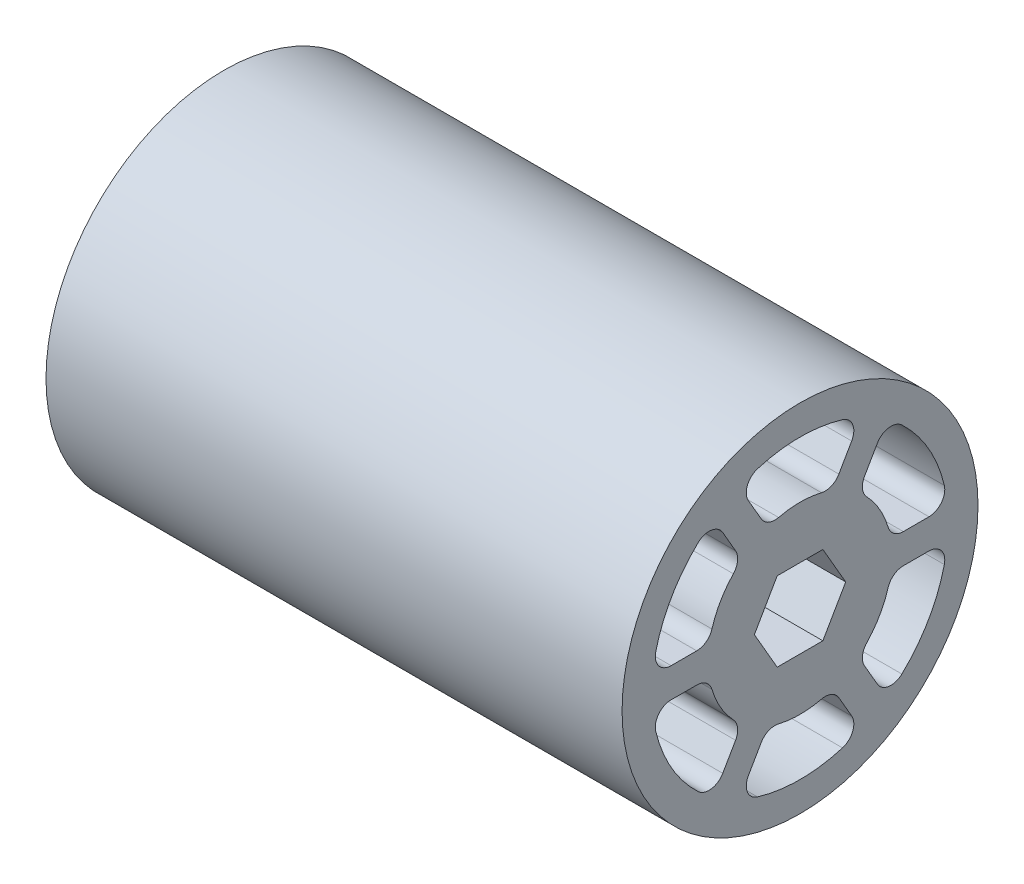
from build123d import *

# Parameters (mm, degrees)
CROQUIS1_R              = 28.575
SALIENTE_EXTRUIR1_DEPTH = 92.5
CORTAR_EXTRUIR1_DEPTH   = 101.942118315


with BuildPart() as part:
    # Croquis1 → Saliente-Extruir1 (new body)
    with BuildSketch(Plane(origin=(0, 0, 0), x_dir=(0, 0, -1), z_dir=(1, 0, 0))):
        Circle(CROQUIS1_R)
        Polygon((7.332348419, 0), (3.666174209, 6.35), (-3.666174209, 6.35), (-7.332348419, 0), (-3.666174209, -6.35), (3.666174209, -6.35), align=None, mode=Mode.SUBTRACT)
    extrude(amount=SALIENTE_EXTRUIR1_DEPTH)

    # Croquis2 → Cortar-Extruir1 (cut, through all)
    with BuildSketch(Plane(origin=(92.5, 0, 0), x_dir=(0, 0, -1), z_dir=(1, 0, 0))):
        with BuildLine():
            Line((-6.233796171, 15.550729765), (-8.292494443, 19.11649977))
            ThreePointArc((-8.292494443, 19.11649977), (-8.452873942, 21.324398032), (-6.820383997, 22.8195612))
            ThreePointArc((-6.820383997, 22.8195612), (0, 23.817682129), (6.820383997, 22.8195612))
            ThreePointArc((6.820383997, 22.8195612), (8.452873942, 21.324398032), (8.292494443, 19.11649977))
            Line((8.292494443, 19.11649977), (6.233796171, 15.550729765))
            ThreePointArc((6.233796171, 15.550729765), (5.037217596, 14.487169273), (3.442097, 14.350965426))
            ThreePointArc((3.442097, 14.350965426), (0, 14.758215751), (-3.442097, 14.350965426))
            ThreePointArc((-3.442097, 14.350965426), (-5.037136467, 14.487358051), (-6.233796171, 15.550729765))
        make_face()
        with BuildLine():
            Line((16.584225109, 2.376739037), (20.701621654, 2.376739037))
            ThreePointArc((20.701621654, 2.376739037), (22.693907387, 3.341795447), (23.172511701, 5.503154795))
            ThreePointArc((23.172511701, 5.503154795), (20.626717783, 11.908841064), (16.352127704, 17.316406405))
            ThreePointArc((16.352127704, 17.316406405), (14.241033445, 17.982602585), (12.409127211, 16.739760733))
            Line((12.409127211, 16.739760733), (10.350428939, 13.173990728))
            ThreePointArc((10.350428939, 13.173990728), (10.027851873, 11.605967168), (10.707252128, 10.156426157))
            ThreePointArc((10.707252128, 10.156426157), (12.780989755, 7.379107875), (14.149349128, 4.194539269))
            ThreePointArc((14.149349128, 4.194539269), (15.064865418, 2.881226234), (16.584225109, 2.376739037))
        make_face()
        with BuildLine():
            Line((10.350428939, -13.173990728), (12.409127211, -16.739760733))
            ThreePointArc((12.409127211, -16.739760733), (14.241033445, -17.982602585), (16.352127704, -17.316406405))
            ThreePointArc((16.352127704, -17.316406405), (20.626717783, -11.908841064), (23.172511701, -5.503154795))
            ThreePointArc((23.172511701, -5.503154795), (22.693907387, -3.341795447), (20.701621654, -2.376739037))
            Line((20.701621654, -2.376739037), (16.584225109, -2.376739037))
            ThreePointArc((16.584225109, -2.376739037), (15.064988339, -2.881390883), (14.149349128, -4.194539269))
            ThreePointArc((14.149349128, -4.194539269), (12.780989755, -7.379107875), (10.707252128, -10.156426157))
            ThreePointArc((10.707252128, -10.156426157), (10.027647822, -11.605943039), (10.350428939, -13.173990728))
        make_face()
        with BuildLine():
            Line((-6.233796171, -15.550729765), (-8.292494443, -19.11649977))
            ThreePointArc((-8.292494443, -19.11649977), (-8.452873942, -21.324398032), (-6.820383997, -22.8195612))
            ThreePointArc((-6.820383997, -22.8195612), (0, -23.817682129), (6.820383997, -22.8195612))
            ThreePointArc((6.820383997, -22.8195612), (8.452873942, -21.324398032), (8.292494443, -19.11649977))
            Line((8.292494443, -19.11649977), (6.233796171, -15.550729765))
            ThreePointArc((6.233796171, -15.550729765), (5.037136467, -14.487358051), (3.442097, -14.350965426))
            ThreePointArc((3.442097, -14.350965426), (0, -14.758215751), (-3.442097, -14.350965426))
            ThreePointArc((-3.442097, -14.350965426), (-5.037217596, -14.487169273), (-6.233796171, -15.550729765))
        make_face()
        with BuildLine():
            Line((-16.584225109, -2.376739037), (-20.701621654, -2.376739037))
            ThreePointArc((-20.701621654, -2.376739037), (-22.693907387, -3.341795447), (-23.172511701, -5.503154795))
            ThreePointArc((-23.172511701, -5.503154795), (-20.626717783, -11.908841064), (-16.352127704, -17.316406405))
            ThreePointArc((-16.352127704, -17.316406405), (-14.241033445, -17.982602585), (-12.409127211, -16.739760733))
            Line((-12.409127211, -16.739760733), (-10.350428939, -13.173990728))
            ThreePointArc((-10.350428939, -13.173990728), (-10.027851873, -11.605967168), (-10.707252128, -10.156426157))
            ThreePointArc((-10.707252128, -10.156426157), (-12.780989755, -7.379107875), (-14.149349128, -4.194539269))
            ThreePointArc((-14.149349128, -4.194539269), (-15.064865418, -2.881226234), (-16.584225109, -2.376739037))
        make_face()
        with BuildLine():
            Line((-10.350428939, 13.173990728), (-12.409127211, 16.739760733))
            ThreePointArc((-12.409127211, 16.739760733), (-14.241033445, 17.982602585), (-16.352127704, 17.316406405))
            ThreePointArc((-16.352127704, 17.316406405), (-20.626717783, 11.908841064), (-23.172511701, 5.503154795))
            ThreePointArc((-23.172511701, 5.503154795), (-22.693907387, 3.341795447), (-20.701621654, 2.376739037))
            Line((-20.701621654, 2.376739037), (-16.584225109, 2.376739037))
            ThreePointArc((-16.584225109, 2.376739037), (-15.064988339, 2.881390883), (-14.149349128, 4.194539269))
            ThreePointArc((-14.149349128, 4.194539269), (-12.780989755, 7.379107875), (-10.707252128, 10.156426157))
            ThreePointArc((-10.707252128, 10.156426157), (-10.027647822, 11.605943039), (-10.350428939, 13.173990728))
        make_face()
    extrude(amount=-CORTAR_EXTRUIR1_DEPTH, mode=Mode.SUBTRACT)


solid = part.part
